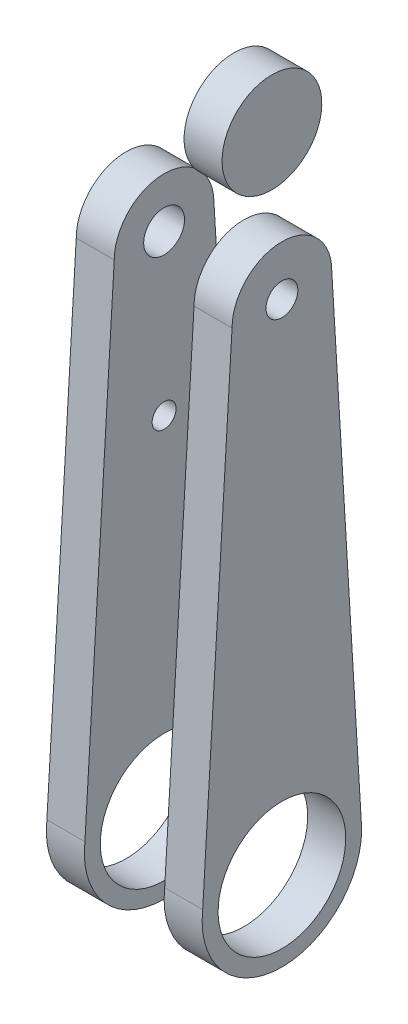
from build123d import *

# Parameters (mm, degrees)
SALIENTE_EXTRUIR1_DEPTH     = 45
CORTAR_EXTRUIR1_START       = -9.53
CORTAR_EXTRUIR1_OUTLINE_R   = 16
CORTAR_EXTRUIR1_OUTLINE_R_2 = 4
CORTAR_EXTRUIR1_DEPTH       = 9.53
CORTAR_EXTRUIR1_2_OUTLINE_R = 12.5
CORTAR_EXTRUIR1_2_DEPTH     = 9.53
CORTAR_EXTRUIR2_DEPTH       = 203.856312695
CORTAR_EXTRUIR2_DEPTH_BACK  = 203.856312695
CROQUIS3_R                  = 3
CROQUIS6_R                  = 4
SALIENTE_EXTRUIR2_DEPTH     = 9.53
CROQUIS7_R                  = 5.125
CORTAR_EXTRUIR3_DEPTH       = 9.53


# Read off the part's stored shape, not the designer's step: Cortar-Extruir1
with BuildPart() as part:
    # Croquis1 → Saliente-Extruir1 (new body)
    with BuildSketch(Plane.XY):
        Polygon((0, -195), (-9.53, -195), (-9.53, -150.957826949), (-9.53, -125.957826949), (-9.53, -37.272336593), (-9.53, -22.648156901), (-9.53, 0), (0, 0), (0, -22.648156901), (0, -37.272336593), (0, -126.527583158), (0, -153), align=None)
    extrude(amount=SALIENTE_EXTRUIR1_DEPTH)

    # Cortar-Extruir1 outline → Cortar-Extruir1 (cut)
    with BuildSketch(Plane(origin=(0, 0, 0), x_dir=(0, 0, -1), z_dir=(1, 0, 0)).offset(CORTAR_EXTRUIR1_START)):
        with Locations((-20, -175)):
            Circle(CORTAR_EXTRUIR1_OUTLINE_R)
        with BuildLine():
            ThreePointArc((-20, -195), (-34.963753203, -188.269743407), (-39.85651654, -172.608609008))
            Line((-39.85651654, -172.608609008), (-32.5, -50))
            ThreePointArc((-32.5, -50), (-20, -37.5), (-7.5, -50))
            Line((-7.5, -50), (-0.14348346, -172.608609008))
            ThreePointArc((-0.14348346, -172.608609008), (-0.035903091, -173.802154186), (0, -175))
            Line((0, -175), (0, 0))
            Line((0, 0), (-45, 0))
            Line((-45, 0), (-45, -195))
            Line((-45, -195), (-20, -195))
        make_face()
        with BuildLine():
            ThreePointArc((0, -175), (-5.857864377, -189.142135624), (-20, -195))
            Line((-20, -195), (0, -195))
            Line((0, -195), (0, -175))
        make_face()
        with Locations((-20, -50)):
            Circle(CORTAR_EXTRUIR1_OUTLINE_R_2)
    extrude(amount=CORTAR_EXTRUIR1_DEPTH, mode=Mode.SUBTRACT)


with BuildPart() as body_2:
    # Cortar-Extruir1 2 outline → Cortar-Extruir1 2 (new body)
    with BuildSketch(Plane(origin=(0, 0, 0), x_dir=(0, 0, -1), z_dir=(1, 0, 0)).offset(CORTAR_EXTRUIR1_START)):
        with Locations((-22.5, -12.5)):
            Circle(CORTAR_EXTRUIR1_2_OUTLINE_R)
    extrude(amount=CORTAR_EXTRUIR1_2_DEPTH)


with BuildPart() as body_3:
    # Simetría2: mirrored copy
    add(part.part.mirror(Plane.ZY.offset(19.53)))

    # Croquis3 → Cortar-Extruir2 (cut, two sides: drawn at the far end of the back side and taken through both)
    with BuildSketch(Plane.ZY.offset(39.06).offset(-CORTAR_EXTRUIR2_DEPTH_BACK)):
        with Locations(Location((20, -90, 0), (0, 0, 270))):
            Circle(CROQUIS3_R)
    extrude(amount=CORTAR_EXTRUIR2_DEPTH + CORTAR_EXTRUIR2_DEPTH_BACK, mode=Mode.SUBTRACT)

    # Croquis6 → Saliente-Extruir2 (add)
    with BuildSketch(Plane.ZY.offset(39.06)):
        with Locations(Location((20, -50, 0), (0, 0, 90))):
            Circle(CROQUIS6_R)
    extrude(amount=-SALIENTE_EXTRUIR2_DEPTH)

    # Croquis7 → Cortar-Extruir3 (cut)
    with BuildSketch(Plane.ZY.offset(39.06)):
        with Locations(Location((20, -50, 0), (0, 0, 270))):
            Circle(CROQUIS7_R)
    extrude(amount=-CORTAR_EXTRUIR3_DEPTH, mode=Mode.SUBTRACT)


solid = Compound([part.part, body_2.part, body_3.part])
